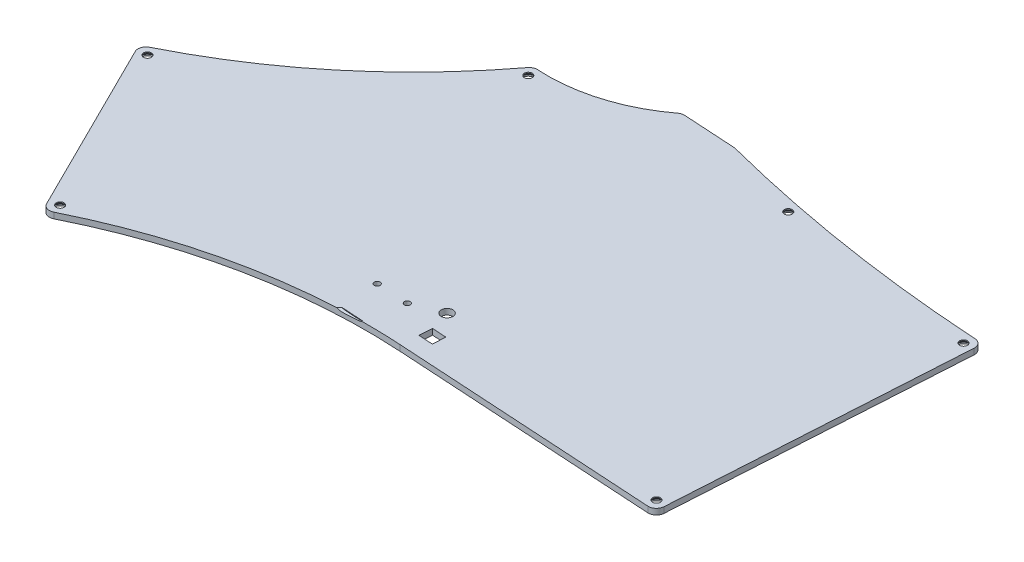
from build123d import *

# Parameters (mm, degrees)
SKETCH1_R                = 1
SKETCH1_R_2              = 2
SKETCH1_R_3              = 1.35
MAIN_PLATE_DEPTH         = 2
SKETCH2_R                = 2.5
SCREW_HOLES_DEPTH        = 1.7
SCREW_HOLES_CHAMFER_SIZE = 1.2


with BuildPart() as part:
    # Sketch1 → Main_plate (new body)
    with BuildSketch(Plane(origin=(0, 0, 0), x_dir=(1, 0, 0), z_dir=(0, 1, 0))):
        with BuildLine():
            Line((-85.7928409, -82.301697444), (-55.755812757, -142.75024532))
            ThreePointArc((-55.755812757, -142.75024532), (-54.140343173, -144.158373046), (-52.002337011, -144.011760212))
            ThreePointArc((-52.002337011, -144.011760212), (-3.951682628, -127.514559525), (46.728283967, -123.969985789))
            Line((46.728283967, -123.969985789), (137.274321343, -129.465618584))
            ThreePointArc((137.274321343, -129.465618584), (139.300267663, -128.766971907), (140.238810242, -126.840393723))
            Line((140.238810242, -126.840393723), (146.327388064, -26.524995005))
            ThreePointArc((146.327388064, -26.524995005), (145.628741387, -24.499048684), (143.702163203, -23.560506106))
            ThreePointArc((143.702163203, -23.560506106), (94.476527457, -18.20079206), (45.987943487, -8.163512858))
            ThreePointArc((45.987943487, -8.163512858), (45.725737799, -8.109235511), (45.459546448, -8.080252452))
            Line((45.459546448, -8.080252452), (27.492609364, -6.989760902))
            ThreePointArc((27.492609364, -6.989760902), (26.515953382, -7.103440368), (25.638814565, -7.547745919))
            ThreePointArc((25.638814565, -7.547745919), (8.167641381, -16.397587105), (-11.285751241, -18.661896472))
            ThreePointArc((-11.285751241, -18.661896472), (-12.626973233, -18.913649552), (-13.689904343, -19.76947284))
            ThreePointArc((-13.689904343, -19.76947284), (-45.694454746, -53.276077835), (-84.531326007, -78.548221698))
            ThreePointArc((-84.531326007, -78.548221698), (-85.939453733, -80.163691282), (-85.7928409, -82.301697444))
        make_face()
        with Locations(Location((24.759473712, -109.793011675, 0), (0, 0, 270))):
            Circle(SKETCH1_R, mode=Mode.SUBTRACT)
        with Locations(Location((35.739268597, -110.459423178, 0), (0, 0, 270))):
            Circle(SKETCH1_R, mode=Mode.SUBTRACT)
        with Locations(Location((45.493229955, -106.563189377, 0), (0, 0, 270))):
            Circle(SKETCH1_R_2, mode=Mode.SUBTRACT)
        with Locations(Location((143.003172699, -26.823913699, 0), (0, 0, 270))):
            Circle(SKETCH1_R_3, mode=Mode.SUBTRACT)
        with Locations(Location((73.916954773, -17.899251104, 0), (0, 0, 270))):
            Circle(SKETCH1_R_3, mode=Mode.SUBTRACT)
        with Locations(Location((-11.217743895, -21.971485999, 0), (0, 0, 270))):
            Circle(SKETCH1_R_3, mode=Mode.SUBTRACT)
        with Locations(Location((-82.615354782, -81.280438678, 0), (0, 0, 270))):
            Circle(SKETCH1_R_3, mode=Mode.SUBTRACT)
        with Locations(Location((-53.022766816, -140.834565069, 0), (0, 0, 270))):
            Circle(SKETCH1_R_3, mode=Mode.SUBTRACT)
        with Locations(Location((136.975163208, -126.141388687, 0), (0, 0, 270))):
            Circle(SKETCH1_R_3, mode=Mode.SUBTRACT)
        Polygon((47.520707964, -113.598943276), (52.411707503, -113.895799309), (52.145142902, -118.287717263), (47.254143363, -117.99086123), align=None, mode=Mode.SUBTRACT)
    extrude(amount=MAIN_PLATE_DEPTH)

    # Sketch2 → Screw_holes (cut)
    with BuildSketch(Plane.XZ):
        with Locations(Location((136.975163208, 126.141388687, 0), (0, 0, 270))):
            Circle(SKETCH2_R)
        with Locations(Location((-53.022766816, 140.834565069, 0), (0, 0, 270))):
            Circle(SKETCH2_R)
        with Locations(Location((-82.615354782, 81.280438678, 0), (0, 0, 270))):
            Circle(SKETCH2_R)
        with Locations(Location((-11.217743895, 21.971485999, 0), (0, 0, 270))):
            Circle(SKETCH2_R)
        with Locations(Location((73.916954773, 17.899251104, 0), (0, 0, 270))):
            Circle(SKETCH2_R)
        with Locations(Location((143.003172699, 26.823913699, 0), (0, 0, 270))):
            Circle(SKETCH2_R)
    extrude(amount=-SCREW_HOLES_DEPTH, mode=Mode.SUBTRACT)

    # Screw_holes_chamfer
    # the kernel refuses this chamfer: 1.2 mm, written as the material it adds along each edge
    with BuildSketch(Plane(origin=(143.003172699, 1.7, 26.823913699), x_dir=(0, 0, -1), z_dir=(-1, 0, 0))) as screw_holes_chamfer_piece_1_section:
        Polygon((2.5, SCREW_HOLES_CHAMFER_SIZE), (2.5 - SCREW_HOLES_CHAMFER_SIZE, 0), (2.5, 0), align=None)
    screw_holes_chamfer_piece_1 = revolve(axis=Axis((143.003172699, 1.7, 26.823913699), (0, -1, 0)), mode=Mode.PRIVATE)
    screw_holes_chamfer_piece_1 = screw_holes_chamfer_piece_1 - Plane(origin=(143.003172699, 1.073479929, 26.823913699), x_dir=(0, 0, 1), z_dir=(0, -1, 0)) * Cylinder(1.35, 10, mode=Mode.PRIVATE)
    add(screw_holes_chamfer_piece_1)
    with BuildSketch(Plane(origin=(73.916954773, 1.7, 17.899251104), x_dir=(0, 0, -1), z_dir=(-1, 0, 0))) as screw_holes_chamfer_piece_2_section:
        Polygon((2.5, SCREW_HOLES_CHAMFER_SIZE), (2.5 - SCREW_HOLES_CHAMFER_SIZE, 0), (2.5, 0), align=None)
    screw_holes_chamfer_piece_2 = revolve(axis=Axis((73.916954773, 1.7, 17.899251104), (0, -1, 0)), mode=Mode.PRIVATE)
    screw_holes_chamfer_piece_2 = screw_holes_chamfer_piece_2 - Plane(origin=(73.916954773, 1.073479929, 17.899251104), x_dir=(0, 0, 1), z_dir=(0, -1, 0)) * Cylinder(1.35, 10, mode=Mode.PRIVATE)
    add(screw_holes_chamfer_piece_2)
    with BuildSketch(Plane(origin=(-11.217743895, 1.7, 21.971485999), x_dir=(0, 0, -1), z_dir=(-1, 0, 0))) as screw_holes_chamfer_piece_3_section:
        Polygon((2.5, SCREW_HOLES_CHAMFER_SIZE), (2.5 - SCREW_HOLES_CHAMFER_SIZE, 0), (2.5, 0), align=None)
    screw_holes_chamfer_piece_3 = revolve(axis=Axis((-11.217743895, 1.7, 21.971485999), (0, -1, 0)), mode=Mode.PRIVATE)
    screw_holes_chamfer_piece_3 = screw_holes_chamfer_piece_3 - Plane(origin=(-11.217743895, 1.073479929, 21.971485999), x_dir=(0, 0, 1), z_dir=(0, -1, 0)) * Cylinder(1.35, 10, mode=Mode.PRIVATE)
    add(screw_holes_chamfer_piece_3)
    with BuildSketch(Plane(origin=(-82.615354782, 1.7, 81.280438678), x_dir=(0, 0, -1), z_dir=(-1, 0, 0))) as screw_holes_chamfer_piece_4_section:
        Polygon((2.5, SCREW_HOLES_CHAMFER_SIZE), (2.5 - SCREW_HOLES_CHAMFER_SIZE, 0), (2.5, 0), align=None)
    screw_holes_chamfer_piece_4 = revolve(axis=Axis((-82.615354782, 1.7, 81.280438678), (0, -1, 0)), mode=Mode.PRIVATE)
    screw_holes_chamfer_piece_4 = screw_holes_chamfer_piece_4 - Plane(origin=(-82.615354782, 1.073479929, 81.280438678), x_dir=(0, 0, 1), z_dir=(0, -1, 0)) * Cylinder(1.35, 11, mode=Mode.PRIVATE)
    add(screw_holes_chamfer_piece_4)
    with BuildSketch(Plane(origin=(-53.022766816, 1.7, 140.834565069), x_dir=(0, 0, -1), z_dir=(-1, 0, 0))) as screw_holes_chamfer_piece_5_section:
        Polygon((2.5, SCREW_HOLES_CHAMFER_SIZE), (2.5 - SCREW_HOLES_CHAMFER_SIZE, 0), (2.5, 0), align=None)
    screw_holes_chamfer_piece_5 = revolve(axis=Axis((-53.022766816, 1.7, 140.834565069), (0, -1, 0)), mode=Mode.PRIVATE)
    screw_holes_chamfer_piece_5 = screw_holes_chamfer_piece_5 - Plane(origin=(-53.022766816, 1.073479929, 140.834565069), x_dir=(0, 0, 1), z_dir=(0, -1, 0)) * Cylinder(1.35, 10, mode=Mode.PRIVATE)
    add(screw_holes_chamfer_piece_5)
    with BuildSketch(Plane(origin=(136.975163208, 1.7, 126.141388687), x_dir=(0, 0, -1), z_dir=(-1, 0, 0))) as screw_holes_chamfer_piece_6_section:
        Polygon((2.5, SCREW_HOLES_CHAMFER_SIZE), (2.5 - SCREW_HOLES_CHAMFER_SIZE, 0), (2.5, 0), align=None)
    screw_holes_chamfer_piece_6 = revolve(axis=Axis((136.975163208, 1.7, 126.141388687), (0, -1, 0)), mode=Mode.PRIVATE)
    screw_holes_chamfer_piece_6 = screw_holes_chamfer_piece_6 - Plane(origin=(136.975163208, 1.073479929, 126.141388687), x_dir=(0, 0, 1), z_dir=(0, -1, 0)) * Cylinder(1.35, 10, mode=Mode.PRIVATE)
    add(screw_holes_chamfer_piece_6)

    # Sketch4 → Cut-Loft1 section 0
    with BuildSketch(Plane(origin=(-7.640186202, 0, 125.879695971), x_dir=(0.9981631713309721, 0, 0.060582863901407005), z_dir=(-0.060582863901407005, 0, 0.9981631713309721))):
        with BuildLine():
            Line((34.465569885, 10.749979768), (39.265569885, 10.749979768))
            ThreePointArc((39.265569885, 10.749979768), (44.515569885, 5.499979768), (39.265569885, 0.249979768))
            Line((39.265569885, 0.249979768), (34.465569885, 0.249979768))
            ThreePointArc((34.465569885, 0.249979768), (29.215569885, 5.499979768), (34.465569885, 10.749979768))
        make_face()
    # Sketch3 → Cut-Loft1 section 1
    with BuildSketch(Plane(origin=(-7.337271882, 0, 120.888880114), x_dir=(0.9981631713309721, 0, 0.060582863901407005), z_dir=(-0.060582863901407005, 0, 0.9981631713309721))):
        with BuildLine():
            Line((34.465569885, 9.25), (39.265569885, 9.25))
            ThreePointArc((39.265569885, 9.25), (43.015590117, 5.499979768), (39.265569885, 1.749959536))
            Line((39.265569885, 1.749959536), (34.465569885, 1.749959536))
            ThreePointArc((34.465569885, 1.749959536), (30.715549653, 5.499979768), (34.465569885, 9.25))
        make_face()
    loft(mode=Mode.SUBTRACT)


solid = part.part
